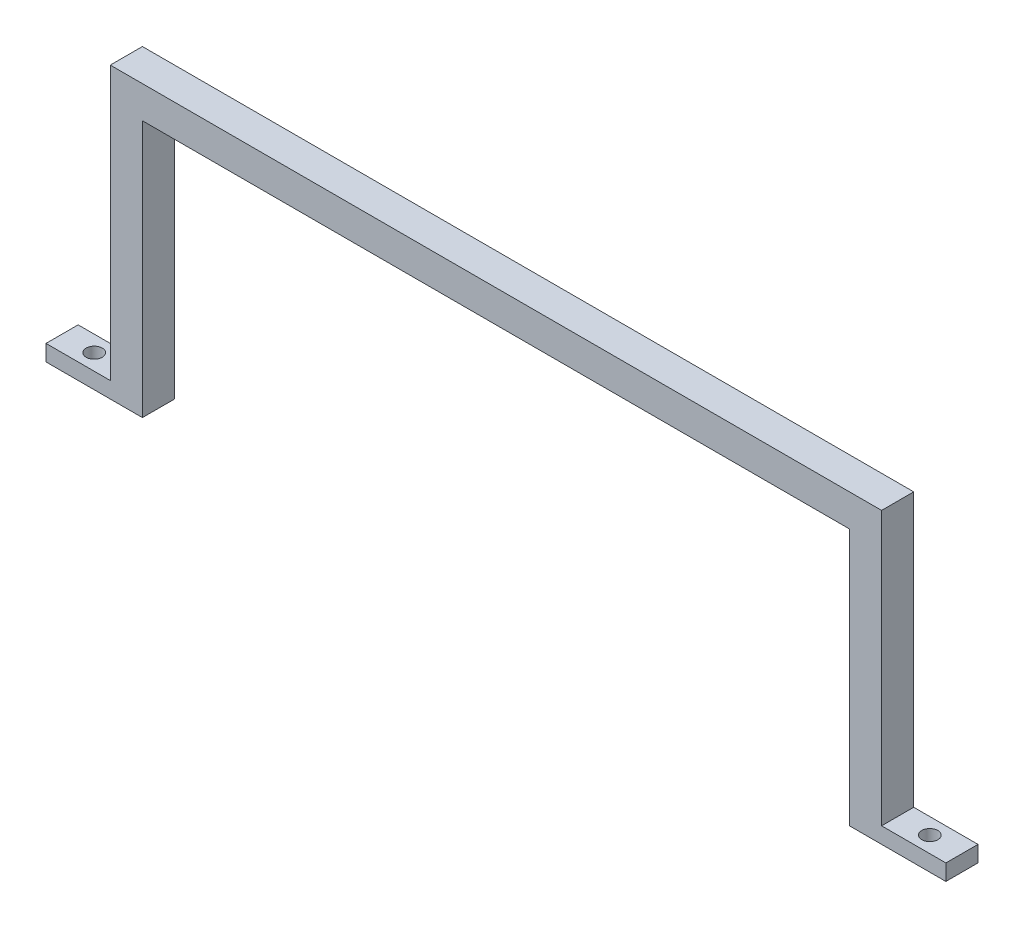
from build123d import *

# Parameters (mm, degrees)
SKETCH1_W           = 152.4
SKETCH1_H           = 6.35
BOSS_EXTRUDE1_DEPTH = 6.35
SKETCH2_W           = 6.35
SKETCH2_H           = 6.35
BOSS_EXTRUDE2_DEPTH = 50.8
SKETCH3_W           = 6.35
SKETCH3_H           = 3.175
BOSS_EXTRUDE3_DEPTH = 12.7
CUT_EXTRUDE1_REACH  = 106.051
SKETCH4_R           = 1.5875


with BuildPart() as part:
    # Sketch1 → Boss-Extrude1 (new body)
    with BuildSketch(Plane(origin=(0, 0, 0), x_dir=(1, 0, 0), z_dir=(0, 1, 0))):
        Rectangle(SKETCH1_W, SKETCH1_H)
    extrude(amount=BOSS_EXTRUDE1_DEPTH)

    # Sketch2 → Boss-Extrude2 (add)
    with BuildSketch(Plane.XZ):
        with Locations((-73.025, 0)):
            Rectangle(SKETCH2_W, SKETCH2_H)
    boss_extrude2 = extrude(amount=BOSS_EXTRUDE2_DEPTH)

    # Sketch3 → Boss-Extrude3 (add)
    with BuildSketch(Plane.ZY.offset(76.2)):
        with Locations((0, -49.2125)):
            Rectangle(SKETCH3_W, SKETCH3_H)
    boss_extrude3 = extrude(amount=BOSS_EXTRUDE3_DEPTH)

    # Mirror1: Boss-Extrude2, Boss-Extrude3 across plane
    add(boss_extrude2.mirror(Plane(origin=(0, 0, 0), x_dir=(0, 0, 1), z_dir=(1, 0, 0))))
    add(boss_extrude3.mirror(Plane(origin=(0, 0, 0), x_dir=(0, 0, 1), z_dir=(1, 0, 0))))

    # Sketch4 → Cut-Extrude1 (cut, up to next)
    with BuildSketch(Plane(origin=(0, -47.625, 0), x_dir=(1, 0, 0), z_dir=(0, 1, 0)), mode=Mode.PRIVATE) as cut_extrude1_sk1:
        with Locations((-82.55, 0)):
            Circle(SKETCH4_R)
    cut_extrude1_tool1 = extrude(cut_extrude1_sk1.sketch, amount=-CUT_EXTRUDE1_REACH, mode=Mode.PRIVATE) & part.part
    cut_extrude1 = cut_extrude1_tool1.solids().sort_by_distance((-82.55, -47.625, 0))[0]
    add(cut_extrude1, mode=Mode.SUBTRACT)

    # Mirror2: Cut-Extrude1 across plane
    add(cut_extrude1.mirror(Plane(origin=(0, 0, 0), x_dir=(0, 0, 1), z_dir=(1, 0, 0))), mode=Mode.SUBTRACT)


solid = part.part
